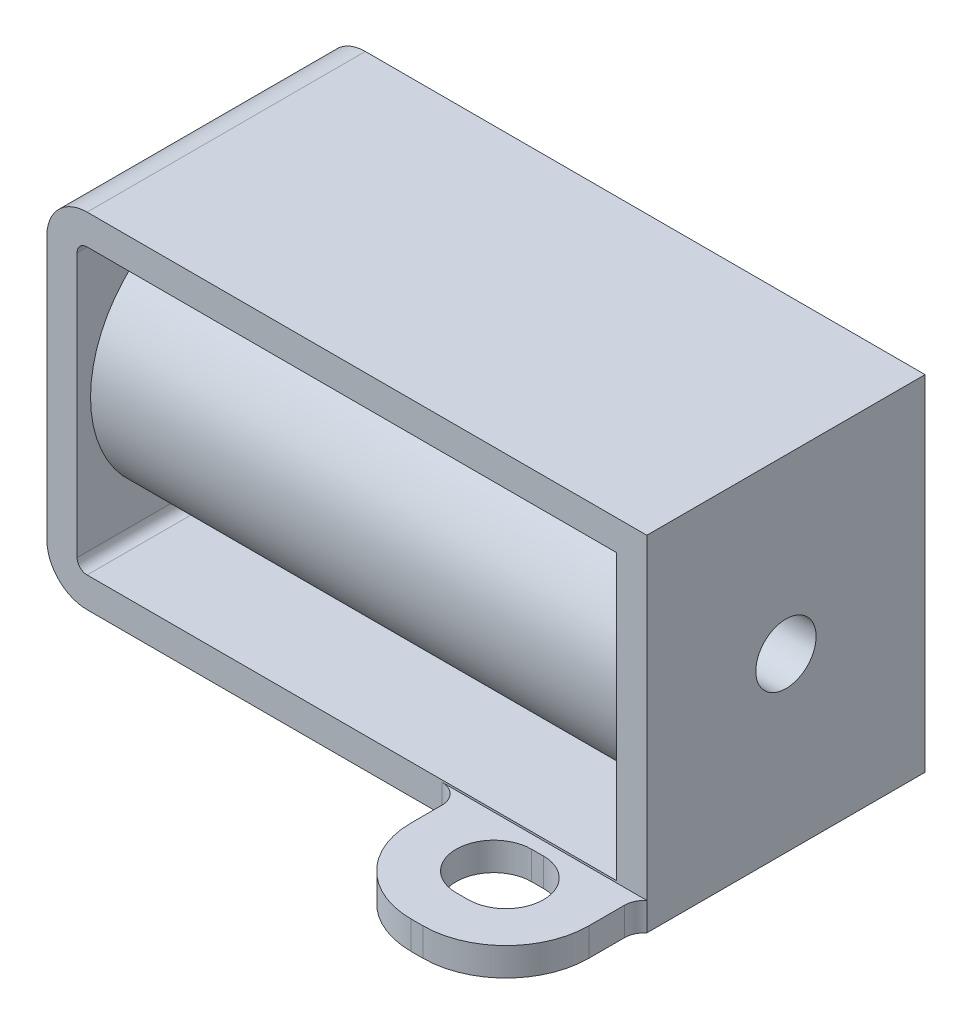
from build123d import *

# Parameters (mm, degrees)
SKETCH1_W           = 13.84
SKETCH1_H           = 17.13
BOSS_EXTRUDE1_DEPTH = 29.84
SKETCH2_R           = 1.5
CUT_EXTRUDE1_DEPTH  = 29.84
BOSS_EXTRUDE2_DEPTH = 1.4
FILLET1_R           = 2
FILLET2_R           = 1
SKETCH4_W           = 10.2
SKETCH4_H           = 1.4
CUT_EXTRUDE2_DEPTH  = 38.202618523
SKETCH5_R           = 6.25
SKETCH5_R_2         = 1.5
BOSS_EXTRUDE3_DEPTH = 26.84


with BuildPart() as part:
    # Sketch1 → Boss-Extrude1 (new body)
    with BuildSketch(Plane(origin=(0, 0, 0), x_dir=(0, 0, -1), z_dir=(1, 0, 0))):
        Rectangle(SKETCH1_W, SKETCH1_H)
    extrude(amount=BOSS_EXTRUDE1_DEPTH)

    # Sketch2 → Cut-Extrude1 (cut)
    with BuildSketch(Plane.ZY):
        Circle(SKETCH2_R)
    extrude(amount=-CUT_EXTRUDE1_DEPTH, mode=Mode.SUBTRACT)

    # Sketch3 → Boss-Extrude2 (add)
    # profile 1 of 2: a face of its own
    with BuildSketch(Plane.XZ.offset(8.565)):
        with BuildLine():
            Line((20.64, 9.455), (20.64, 6.92))
            Line((20.64, 6.92), (29.49, 6.92))
            Line((29.49, 6.92), (29.49, 9.455))
            ThreePointArc((29.49, 9.455), (28.281815472, 12.371815472), (25.365, 13.58))
            Line((25.365, 13.58), (24.765, 13.58))
            ThreePointArc((24.765, 13.58), (21.848184528, 12.371815472), (20.64, 9.455))
        make_face()
        with BuildLine():
            ThreePointArc((24.765, 7.58), (22.89, 9.455), (24.765, 11.33))
            Line((24.765, 11.33), (25.365, 11.33))
            ThreePointArc((25.365, 11.33), (27.24, 9.455), (25.365, 7.58))
            Line((25.365, 7.58), (24.765, 7.58))
        make_face(mode=Mode.SUBTRACT)
    # profile 2 of 2: a face of its own
    with BuildSketch(Plane.XZ.offset(8.565)):
        with BuildLine():
            Line((3.84, -6.92), (3.84, -9.455))
            ThreePointArc((3.84, -9.455), (5.048184528, -12.371815472), (7.965, -13.58))
            Line((7.965, -13.58), (8.565, -13.58))
            ThreePointArc((8.565, -13.58), (11.481815472, -12.371815472), (12.69, -9.455))
            Line((12.69, -9.455), (12.69, -6.92))
            Line((12.69, -6.92), (3.84, -6.92))
        make_face()
        with BuildLine():
            ThreePointArc((8.565, -7.58), (10.44, -9.455), (8.565, -11.33))
            Line((8.565, -11.33), (7.965, -11.33))
            ThreePointArc((7.965, -11.33), (6.09, -9.455), (7.965, -7.58))
            Line((7.965, -7.58), (8.565, -7.58))
        make_face(mode=Mode.SUBTRACT)
    extrude(amount=-BOSS_EXTRUDE2_DEPTH)

    # Fillet1
    fillet1_edges = [part.edges().sort_by_distance(p)[0] for p in [
        (0, -8.565, 0),
        (0, 8.565, 0),
    ]]
    fillet(fillet1_edges, radius=FILLET1_R)

    # Fillet2
    # the kernel refuses this fillet: 1 mm, written as the material it adds along each edge
    with BuildSketch(Plane(origin=(3.84, -8.565, -6.92), x_dir=(-1, 0, 0), z_dir=(0, 1, 0))) as fillet2_piece_1:
        with BuildLine():
            CenterArc((FILLET2_R, -FILLET2_R), FILLET2_R, 90, 90)
            Line((0, -FILLET2_R), (-FILLET2_R * 0.02, -FILLET2_R))
            Line((-FILLET2_R * 0.02, -FILLET2_R), (-FILLET2_R * 0.02, FILLET2_R * 0.02))
            Line((-FILLET2_R * 0.02, FILLET2_R * 0.02), (FILLET2_R, FILLET2_R * 0.02))
            Line((FILLET2_R, FILLET2_R * 0.02), (FILLET2_R, 0))
        make_face()
    extrude(amount=1.4)
    with BuildSketch(Plane(origin=(20.64, -8.565, 6.92), x_dir=(-1, 0, 0), z_dir=(0, 1, 0)), Plane(origin=(12.69, -8.565, -6.92), x_dir=(1, 0, 0), z_dir=(0, 1, 0))) as fillet2_piece_2:
        with BuildLine():
            CenterArc((FILLET2_R, FILLET2_R), FILLET2_R, 180, 90)
            Line((0, FILLET2_R), (-FILLET2_R * 0.02, FILLET2_R))
            Line((-FILLET2_R * 0.02, FILLET2_R), (-FILLET2_R * 0.02, -FILLET2_R * 0.02))
            Line((-FILLET2_R * 0.02, -FILLET2_R * 0.02), (FILLET2_R, -FILLET2_R * 0.02))
            Line((FILLET2_R, -FILLET2_R * 0.02), (FILLET2_R, 0))
        make_face()
    extrude(amount=1.4)
    with BuildSketch(Plane(origin=(29.49, -8.565, 6.92), x_dir=(1, 0, 0), z_dir=(0, 1, 0))) as fillet2_piece_3:
        with BuildLine():
            CenterArc((1, -0.759934208), FILLET2_R, 130.541601874, 49.458398126)
            Line((0, -0.759934208), (-0.02, -0.759934208))
            Line((-0.02, -0.759934208), (-0.02, 0))
            Line((-0.02, 0), (0, 0.02))
            ThreePointArc((0, 0.02), (0.175, 0.02), (0.337, 0.015198684))
            Line((0.337, 0.015198684), (0.35, 0))
        make_face()
    extrude(amount=1.4)

    # Sketch4 → Cut-Extrude2 (cut, through all)
    with BuildSketch(Plane.XY.offset(6.92)):
        with BuildLine():
            Line((18.14, -7.065), (18.14, -5.665))
            Line((18.14, -5.665), (28.34, -5.665))
            Line((28.34, -5.665), (28.34, 7.065))
            Line((28.34, 7.065), (2, 7.065))
            ThreePointArc((2, 7.065), (1.646446609, 6.918553391), (1.5, 6.565))
            Line((1.5, 6.565), (1.5, -6.565))
            ThreePointArc((1.5, -6.565), (1.646446609, -6.918553391), (2, -7.065))
            Line((2, -7.065), (18.14, -7.065))
        make_face()
        with Locations((23.24, -6.365)):
            Rectangle(SKETCH4_W, SKETCH4_H)
    extrude(amount=-CUT_EXTRUDE2_DEPTH, mode=Mode.SUBTRACT)

    # Sketch5 → Boss-Extrude3 (add)
    with BuildSketch(Plane(origin=(1.5, 0, 0), x_dir=(0, 0, -1), z_dir=(1, 0, 0))):
        with Locations(Location((0, 0, 0), (0, 0, 270))):
            Circle(SKETCH5_R)
        with Locations(Location((0, 0, 0), (0, 0, 180))):
            Circle(SKETCH5_R_2, mode=Mode.SUBTRACT)
    extrude(amount=BOSS_EXTRUDE3_DEPTH)


solid = part.part
